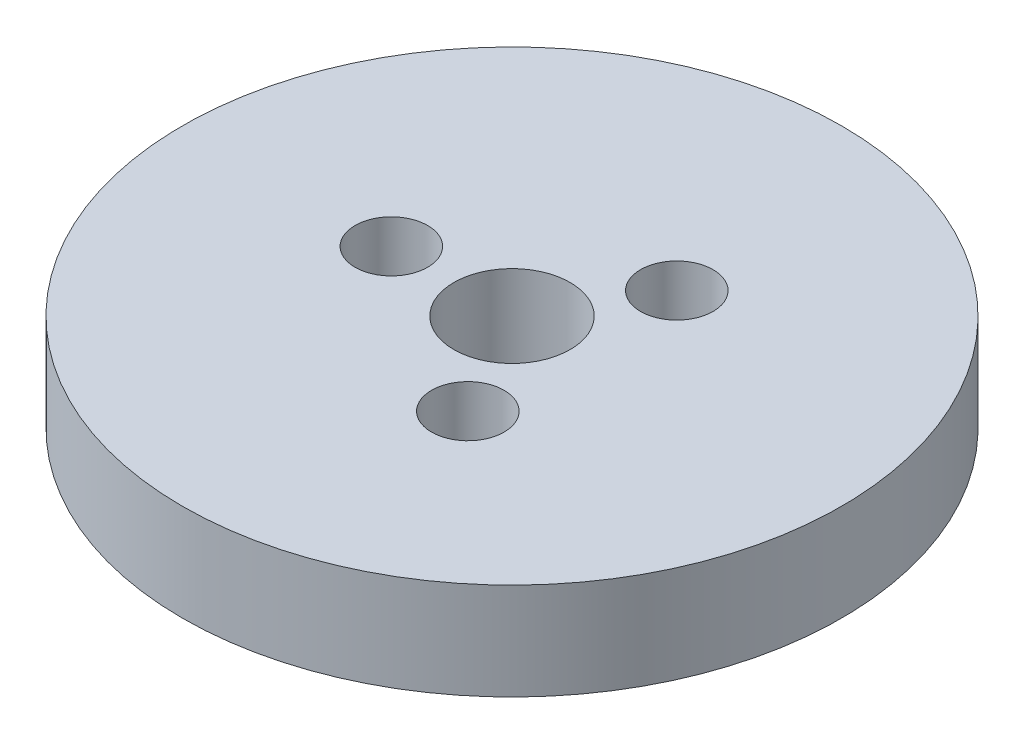
from build123d import *

# Parameters (mm, degrees)
SKETCH1_R           = 85
BOSS_EXTRUDE1_DEPTH = 25
SKETCH2_R           = 15
CUT_EXTRUDE1_DEPTH  = 123.780291578
SKETCH3_R           = 9.352625776
CUT_EXTRUDE2_DEPTH  = 17.571575054
CIRPATTERN1_COUNT   = 3


with BuildPart() as part:
    # Sketch1 → Boss-Extrude1 (new body)
    with BuildSketch(Plane(origin=(0, 0, 0), x_dir=(1, 0, 0), z_dir=(0, 1, 0))):
        Circle(SKETCH1_R)
    extrude(amount=BOSS_EXTRUDE1_DEPTH)

    # Sketch2 → Cut-Extrude1 (cut, through all)
    with BuildSketch(Plane(origin=(0, 0, 0), x_dir=(1, 0, 0), z_dir=(0, 1, 0))):
        Circle(SKETCH2_R)
    extrude(amount=CUT_EXTRUDE1_DEPTH, mode=Mode.SUBTRACT)

    # Sketch3 → Cut-Extrude2 (cut)
    with BuildSketch(Plane(origin=(0, 25, 0), x_dir=(1, 0, 0), z_dir=(0, 1, 0))):
        with Locations((-31.118030631, 0)):
            Circle(SKETCH3_R)
    cut_extrude2 = extrude(amount=-CUT_EXTRUDE2_DEPTH, mode=Mode.SUBTRACT)

    # CirPattern1: Cut-Extrude2 ×3 about axis
    cirpattern1_axis = Axis((0, 0, 0), (0, 1, 0))
    for i in range(1, CIRPATTERN1_COUNT):
        add(cut_extrude2.rotate(cirpattern1_axis, i * 360 / CIRPATTERN1_COUNT), mode=Mode.SUBTRACT)


solid = part.part
